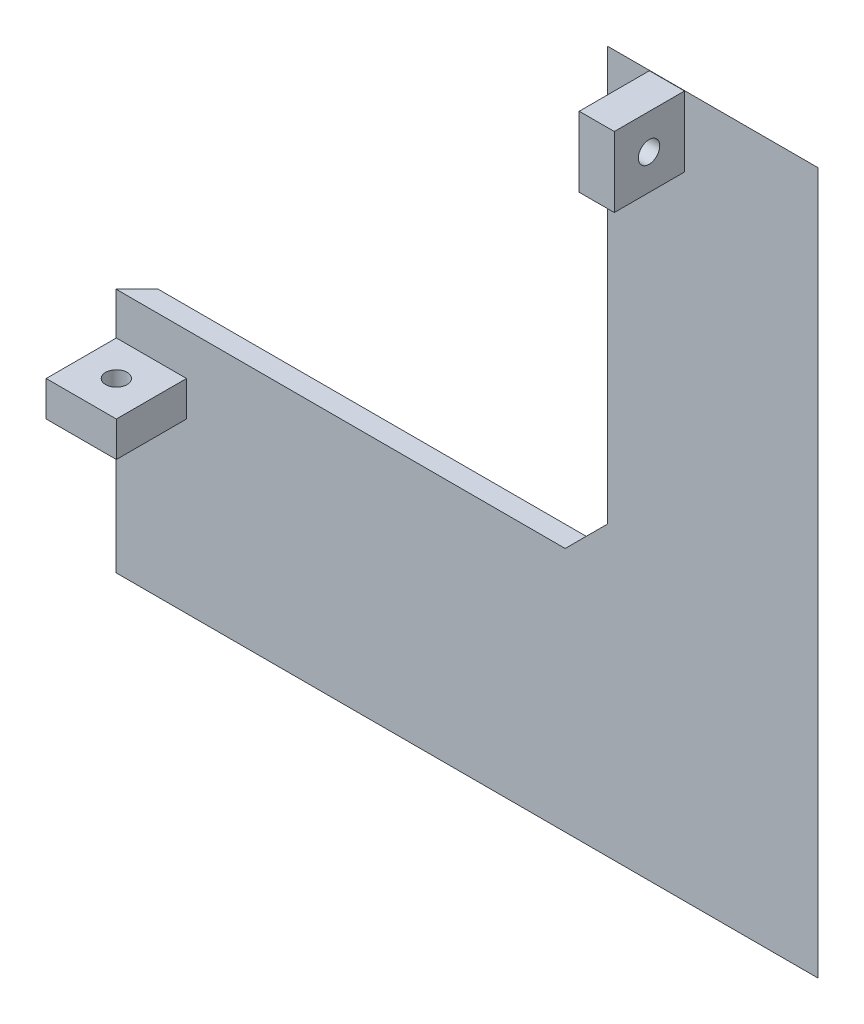
from build123d import *

# Parameters (mm, degrees)
ESQUISSE1_W             = 100
ESQUISSE1_H             = 100
BOSS_EXTRU_1_DEPTH      = 3
CHANFREIN2_SIZE         = 3
ESQUISSE4_W             = 5
ESQUISSE4_H             = 10
ESQUISSE4_W_2           = 10
ESQUISSE4_H_2           = 5
BOSS_EXTRU_3_DEPTH      = 10
ESQUISSE5_R             = 1.525
ENL_V_MAT_EXTRU_2_DEPTH = 10
ESQUISSE6_R             = 1.525
ENL_V_MAT_EXTRU_3_DEPTH = 10
ESQUISSE7_W             = 70
ESQUISSE7_H             = 65
ENL_V_MAT_EXTRU_4_DEPTH = 10
CHANFREIN3_SIZE         = 6


with BuildPart() as part:
    # Esquisse1 → Boss.-Extru.1 (new body)
    with BuildSketch(Plane.XY):
        with Locations((50, 50)):
            Rectangle(ESQUISSE1_W, ESQUISSE1_H)
    extrude(amount=BOSS_EXTRU_1_DEPTH)

    # Chanfrein2
    chanfrein2_edges = [part.edges().sort_by_distance(p)[0] for p in [
        (50, 0, 0),
        (100, 50, 0),
        (50, 100, 0),
        (0, 50, 0),
    ]]
    chamfer(chanfrein2_edges, length=CHANFREIN2_SIZE - 0.0001)  # a hair under: the kernel refuses the full size

    # Esquisse4 → Boss.-Extru.3 (add)
    with BuildSketch(Plane.XY.offset(3)):
        with Locations((78.5, 94.95)):
            Rectangle(ESQUISSE4_W, ESQUISSE4_H)
        with Locations((5.05, 26.5)):
            Rectangle(ESQUISSE4_W_2, ESQUISSE4_H_2)
    extrude(amount=BOSS_EXTRU_3_DEPTH)

    # Esquisse5 → Enlèv. mat.-Extru.2 (cut)
    with BuildSketch(Plane(origin=(81, 0, 0), x_dir=(0, 0, -1), z_dir=(1, 0, 0))):
        with Locations((-8.05, 94.95)):
            Circle(ESQUISSE5_R)
    extrude(amount=-ENL_V_MAT_EXTRU_2_DEPTH, mode=Mode.SUBTRACT)

    # Esquisse6 → Enlèv. mat.-Extru.3 (cut)
    with BuildSketch(Plane(origin=(0, 29, 0), x_dir=(1, 0, 0), z_dir=(0, 1, 0))):
        with Locations(Location((5.05, -8, 0), (0, 0, 270))):
            Circle(ESQUISSE6_R)
    extrude(amount=-ENL_V_MAT_EXTRU_3_DEPTH, mode=Mode.SUBTRACT)

    # Esquisse7 → Enlèv. mat.-Extru.4 (cut)
    with BuildSketch(Plane.XY.offset(3)):
        with Locations((35, 67.5)):
            Rectangle(ESQUISSE7_W, ESQUISSE7_H)
    extrude(amount=-ENL_V_MAT_EXTRU_4_DEPTH, mode=Mode.SUBTRACT)

    # Chanfrein3
    chanfrein3_edges = [part.edges().sort_by_distance(p)[0] for p in [
        (70, 35, 1.5),
    ]]
    chamfer(chanfrein3_edges, length=CHANFREIN3_SIZE)


solid = part.part
